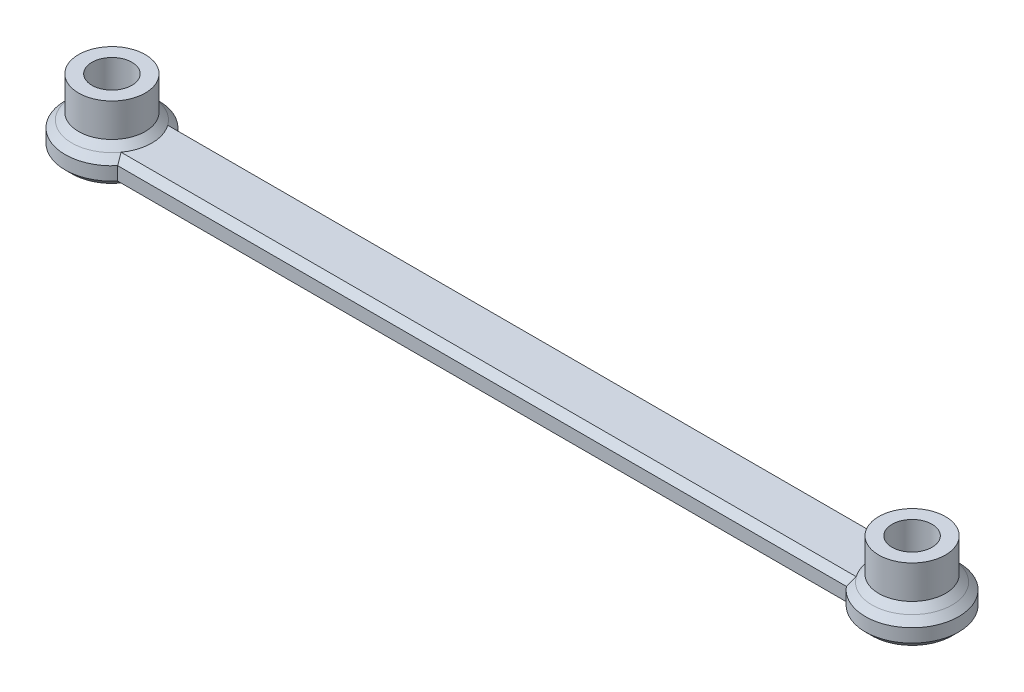
from build123d import *

# Parameters (mm, degrees)
SKETCH1_R           = 5
BOSS_EXTRUDE1_DEPTH = 4
SKETCH1_3_R         = 5
SKETCH1_3_R_2       = 3
BOSS_EXTRUDE2_DEPTH = 10
CHAMFER1_SIZE       = 1
CHAMFER2_SIZE       = 1


with BuildPart() as part:
    # Sketch1 → Boss-Extrude1 (new body)
    with BuildSketch(Plane(origin=(0, 0, 0), x_dir=(1, 0, 0), z_dir=(0, 1, 0))):
        with BuildLine():
            ThreePointArc((54.638097353, 4.5), (67, 0), (54.638097353, -4.5))
            Line((54.638097353, -4.5), (-54.638097353, -4.5))
            ThreePointArc((-54.638097353, -4.5), (-67, 0), (-54.638097353, 4.5))
            Line((-54.638097353, 4.5), (54.638097353, 4.5))
        make_face()
        with Locations(Location((-60, 0, 0), (0, 0, 270))):
            Circle(SKETCH1_R, mode=Mode.SUBTRACT)
        with Locations(Location((60, 0, 0), (0, 0, 270))):
            Circle(SKETCH1_R, mode=Mode.SUBTRACT)
    extrude(amount=BOSS_EXTRUDE1_DEPTH)

    # Sketch1<3> → Boss-Extrude2 (add)
    # profile 1 of 2: a face of its own
    with BuildSketch(Plane(origin=(0, 0, 0), x_dir=(1, 0, 0), z_dir=(0, 1, 0))):
        with Locations(Location((-60, 0, 0), (0, 0, 270))):
            Circle(SKETCH1_3_R)
        with Locations(Location((-60, 0, 0), (0, 0, 270))):
            Circle(SKETCH1_3_R_2, mode=Mode.SUBTRACT)
    # profile 2 of 2: a face of its own
    with BuildSketch(Plane(origin=(0, 0, 0), x_dir=(1, 0, 0), z_dir=(0, 1, 0))):
        with Locations(Location((60, 0, 0), (0, 0, 270))):
            Circle(SKETCH1_3_R)
        with Locations(Location((60, 0, 0), (0, 0, 270))):
            Circle(SKETCH1_3_R_2, mode=Mode.SUBTRACT)
    extrude(amount=BOSS_EXTRUDE2_DEPTH)

    # Chamfer1
    chamfer1_edges = [part.edges().sort_by_distance(p)[0] for p in [
        (-60, 4, -5),
        (60, 4, -5),
    ]]
    chamfer(chamfer1_edges, length=CHAMFER1_SIZE)

    # Chamfer2
    chamfer2_edges = [part.edges().sort_by_distance(p)[0] for p in [
        (0, 4, -4.5),
        (-67, 4, 0),
        (0, 4, 4.5),
        (67, 4, 0),
        (0, 0, 4.5),
        (-67, 0, 0),
        (0, 0, -4.5),
        (67, 0, 0),
    ]]
    chamfer(chamfer2_edges, length=CHAMFER2_SIZE - 0.0001)  # a hair under: the kernel refuses the full size


solid = part.part
